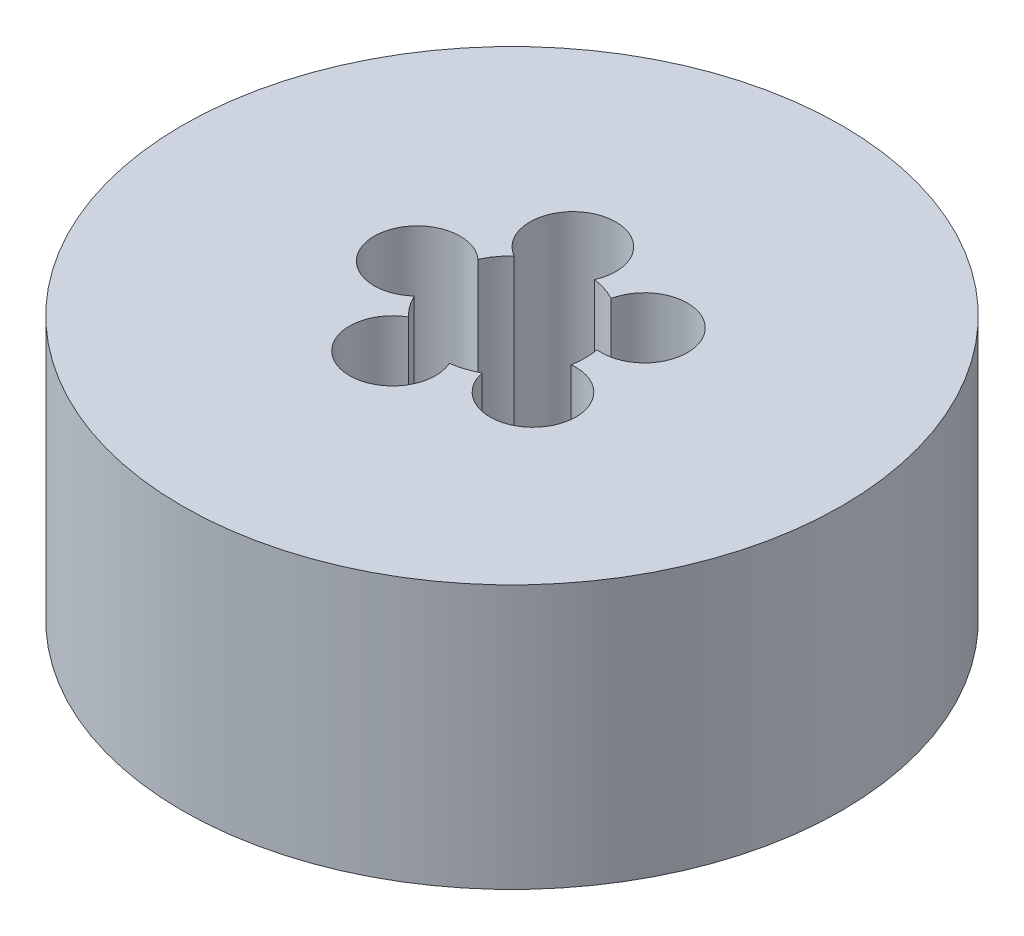
from build123d import *

# Parameters (mm, degrees)
SKETCH1_R           = 22.5
BOSS_EXTRUDE1_DEPTH = 18
SKETCH2_R           = 5
CUT_EXTRUDE1_DEPTH  = 37.558172821
SKETCH3_R           = 2.936270552
CUT_EXTRUDE2_DEPTH  = 12.542477902
CIRPATTERN1_COUNT   = 5


with BuildPart() as part:
    # Sketch1 → Boss-Extrude1 (new body)
    with BuildSketch(Plane(origin=(0, 0, 0), x_dir=(1, 0, 0), z_dir=(0, 1, 0))):
        Circle(SKETCH1_R)
    extrude(amount=BOSS_EXTRUDE1_DEPTH)

    # Sketch2 → Cut-Extrude1 (cut, through all)
    with BuildSketch(Plane(origin=(0, 0, 0), x_dir=(1, 0, 0), z_dir=(0, 1, 0))):
        Circle(SKETCH2_R)
    extrude(amount=CUT_EXTRUDE1_DEPTH, mode=Mode.SUBTRACT)

    # Sketch3 → Cut-Extrude2 (cut)
    with BuildSketch(Plane(origin=(0, 18, 0), x_dir=(1, 0, 0), z_dir=(0, 1, 0))):
        with Locations((-6.469940235, 0)):
            Circle(SKETCH3_R)
    cut_extrude2 = extrude(amount=-CUT_EXTRUDE2_DEPTH, mode=Mode.SUBTRACT)

    # CirPattern1: Cut-Extrude2 ×5 about axis
    cirpattern1_axis = Axis((0, 0, 0), (0, 1, 0))
    for i in range(1, CIRPATTERN1_COUNT):
        add(cut_extrude2.rotate(cirpattern1_axis, i * 360 / CIRPATTERN1_COUNT), mode=Mode.SUBTRACT)


solid = part.part
